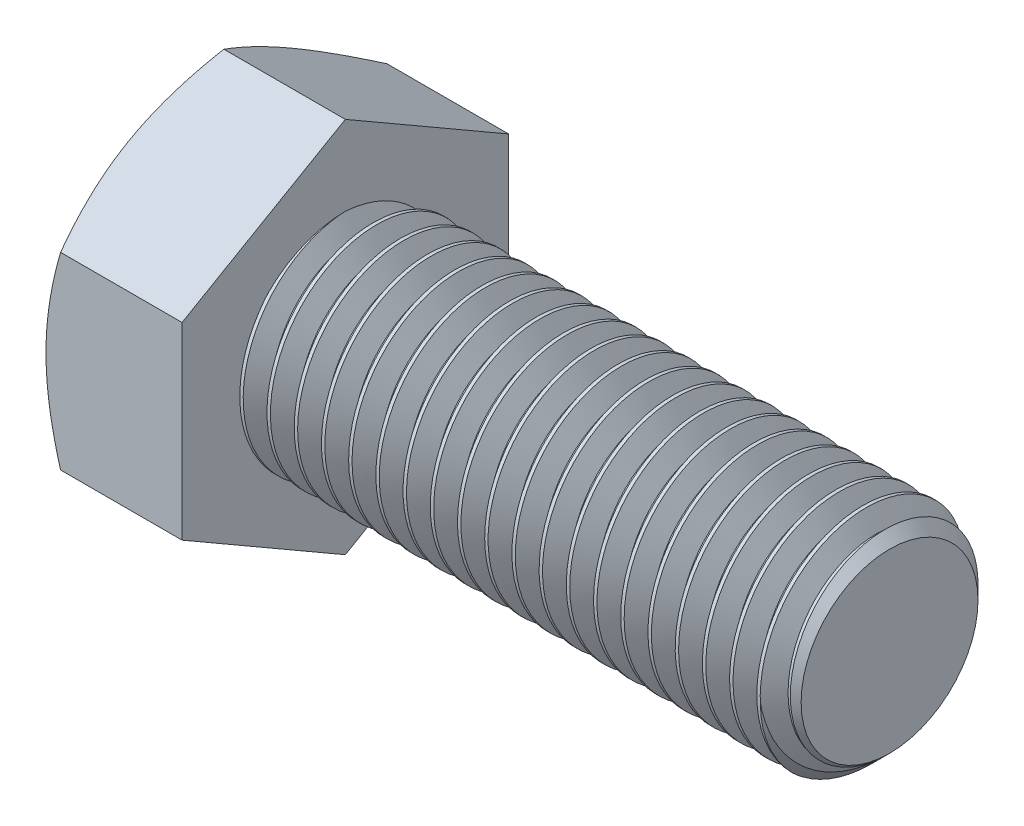
from build123d import *

# Parameters (mm, degrees)
SKETCH2_R           = 10
BOSS_EXTRUDE1_DEPTH = 50
CHAMFER1_SIZE       = 1.875
CUT_SWEEP1_PITCH    = 2.5
BOSS_EXTRUDE2_DEPTH = 12.5
SKETCH6_OUTSIDE_W   = 281.562
SKETCH6_OUTSIDE_H   = 286.204
SKETCH6_OUTSIDE_R   = 15
CUT_EXTRUDE1_DEPTH  = 67.567634921
CUT_EXTRUDE1_DRAFT  = -60


with BuildPart() as part:
    # Sketch2 → Boss-Extrude1 (new body)
    with BuildSketch(Plane(origin=(31.25, 0, 0), x_dir=(0, 0, -1), z_dir=(1, 0, 0))):
        Circle(SKETCH2_R)
    extrude(amount=-BOSS_EXTRUDE1_DEPTH)

    # Chamfer1
    chamfer1_edges = [part.edges().sort_by_distance(p)[0] for p in [
        (31.25, 0, 10),
    ]]
    chamfer(chamfer1_edges, length=CHAMFER1_SIZE)

    # Cut-Sweep1: the profile of Sketch5 profile screwed along a right-hand helix of 21 turns, 10 arcs to a turn; built about Z, then put on its axis
    cut_sweep1_z = Axis((0, 0, 0), (0, 0, 1))
    cut_sweep1_corners = [(10.0003, 0, 0.000173205), (8.376202368, 0, -0.9375), (8.376202368, 0, -1.25), (10.0003, 0, -2.187673205)]
    with BuildLine(mode=Mode.PRIVATE) as cut_sweep1_profile:
        Line(cut_sweep1_corners[0], cut_sweep1_corners[1])
        Line(cut_sweep1_corners[1], cut_sweep1_corners[2])
        Line(cut_sweep1_corners[2], cut_sweep1_corners[3])
        Line(cut_sweep1_corners[3], cut_sweep1_corners[0])
    cut_sweep1_cap = Face(cut_sweep1_profile.wire())
    cut_sweep1_turn_angles = [0, 18, 36, 54, 72, 90, 108, 126, 144, 162, 180, 198, 216, 234, 252, 270, 288, 306, 324, 342, 360]
    cut_sweep1_turn_weights = [1, 0.9510565162951535, 1, 0.9510565162951535, 1, 0.9510565162951535, 1, 0.9510565162951535, 1, 0.9510565162951535, 1, 0.9510565162951535, 1, 0.9510565162951535, 1, 0.9510565162951535, 1, 0.9510565162951535, 1, 0.9510565162951535, 1]
    cut_sweep1_turn_rails = [Edge.make_bspline([Vector(p[0], p[1], 0).rotate(cut_sweep1_z, cut_sweep1_turn_angles[k]) / cut_sweep1_turn_weights[k] + Vector(0, 0, p[2] + CUT_SWEEP1_PITCH * cut_sweep1_turn_angles[k] / 360) for k in range(21)], [0, 0, 0, 1, 1, 2, 2, 3, 3, 4, 4, 5, 5, 6, 6, 7, 7, 8, 8, 9, 9, 10, 10, 10], 2, cut_sweep1_turn_weights) for p in cut_sweep1_corners]
    cut_sweep1_turn_sides = [Face.make_surface_from_curves(cut_sweep1_turn_rails[p[0]], cut_sweep1_turn_rails[p[1]]) for p in [(0, 1), (1, 2), (2, 3), (3, 0)]]
    cut_sweep1 = Plane(origin=(31.25, 0, 0), x_dir=(0, 1, 0), z_dir=(-1, 0, 0)) * Solid(Shell([*[p.moved(Location((0, 0, CUT_SWEEP1_PITCH * i))) for i in range(21) for p in cut_sweep1_turn_sides], cut_sweep1_cap, cut_sweep1_cap.rotate(cut_sweep1_z, 7560).moved(Location((0, 0, CUT_SWEEP1_PITCH * 7560 / 360)))]))
    add(cut_sweep1, mode=Mode.SUBTRACT)

    # Sketch3 → Boss-Extrude2 (add)
    with BuildSketch(Plane.ZY.offset(18.75)):
        Polygon((-15, -8.660254038), (0, -17.320508076), (15, -8.660254038), (15, 8.660254038), (0, 17.320508076), (-15, 8.660254038), align=None)
    extrude(amount=BOSS_EXTRUDE2_DEPTH)


with BuildPart() as cut_extrude1_tool:
    # Sketch6 outside → Cut-Extrude1 (with draft: the straight prism first)
    with BuildSketch(Plane.ZY.offset(31.25)):
        Rectangle(SKETCH6_OUTSIDE_W, SKETCH6_OUTSIDE_H)
        Circle(SKETCH6_OUTSIDE_R, mode=Mode.SUBTRACT)
    extrude(amount=-CUT_EXTRUDE1_DEPTH)
    # Cut-Extrude1: the draft: its side faces are tilted about the plane it starts from
    cut_extrude1_sides = [cut_extrude1_tool.faces().sort_by_distance(p)[0] for p in [
        (2.53381746, -143.102, 0),
        (2.53381746, 0, 140.781),
        (2.53381746, 143.102, 0),
        (2.53381746, 0, -140.781),
        (2.53381746, 0, -15),
    ]]
    draft(cut_extrude1_sides, Plane.ZY.offset(31.25), CUT_EXTRUDE1_DRAFT)


with BuildPart() as part_1:
    add(part.part)

    # Cut-Extrude1: cut by cut_extrude1_tool
    add(cut_extrude1_tool.part, mode=Mode.SUBTRACT)


solid = part_1.part
